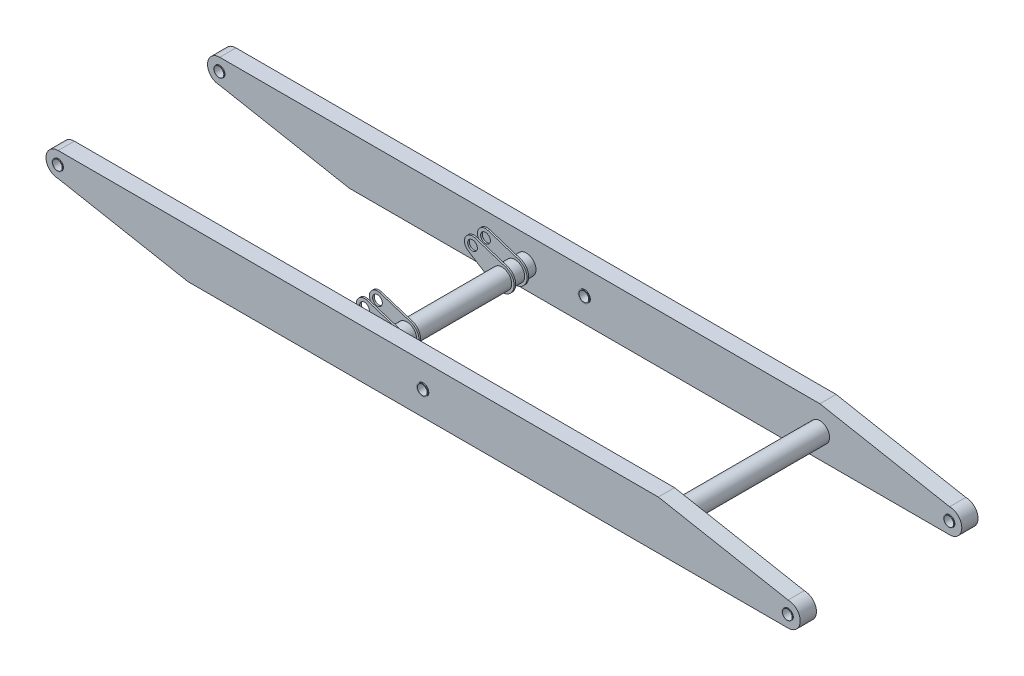
from build123d import *

# Parameters (mm, degrees)
EXTRUDE_1_DEPTH        = 100
SKETCH_2_R             = 30
CUT_EXTRUDE_1_DEPTH    = 100
SKETCH_3_R             = 32.5
SKETCH_3_R_2           = 30
EXTRUDE_2_DEPTH        = 5
EXTRUDE_START          = 5
SKETCH_4_R             = 32.5
SKETCH_4_R_2           = 30
EXTRUDE_3_DEPTH        = 5
SKETCH_5_R             = 30
CUT_EXTRUDE_3_DEPTH    = 552
SKETCH_6_R             = 35
SKETCH_6_R_2           = 30
EXTRUDE_4_DEPTH        = 5
SKETCH_7_R             = 35
SKETCH_7_R_2           = 30
EXTRUDE_5_DEPTH        = 5
SKETCH_8_R             = 60
EXTRUDE_6_DEPTH        = 448
SKETCH_9_R             = 60
EXTRUDE_7_DEPTH        = 896
EXTRUDE_8_DEPTH        = 10
EXTRUDE_10_DEPTH       = 10
CUT_EXTRUDE_START      = -10
CUT_EXTRUDE_6_DEPTH    = 10
PATTERN_LINEAR_2_COUNT = 2
PATTERN_LINEAR_2_PITCH = 80
SKETCH_16_R            = 30
CUT_EXTRUDE_7_DEPTH    = 95
MIRROR_START           = -160
MIRROR_3_OUTLINE_R     = 30
MIRROR_3_DEPTH         = 10
MIRROR_START_2         = -80
MIRROR_3_2_OUTLINE_R   = 30
MIRROR_3_2_DEPTH       = 10
SCALE1_SCALE           = 0.345


# Read off the part's stored shape, not the designer's step: 镜向3
with BuildPart() as part:
    # 草图1 → 凸台-拉伸1 (new body)
    with BuildSketch(Plane.XY):
        with BuildLine():
            Line((-60.1323511, -127.533248731), (739.8676489, -277.533248731))
            Line((739.8676489, -277.533248731), (4439.8676489, -277.533248731))
            ThreePointArc((4439.8676489, -277.533248731), (4514.8676489, -202.533248731), (4439.8676489, -127.533248731))
            Line((4439.8676489, -127.533248731), (3639.8676489, 22.466751269))
            Line((3639.8676489, 22.466751269), (-60.1323511, 22.466751269))
            ThreePointArc((-60.1323511, 22.466751269), (-135.1323511, -52.533248731), (-60.1323511, -127.533248731))
        make_face()
    extrude(amount=EXTRUDE_1_DEPTH)

    # 草图2 → 切除-拉伸1 (cut)
    with BuildSketch(Plane.XY.offset(100)):
        with Locations((-60.1323511, -52.533248731)):
            Circle(SKETCH_2_R)
        with Locations((4439.8676489, -202.533248731)):
            Circle(SKETCH_2_R)
    extrude(amount=-CUT_EXTRUDE_1_DEPTH, mode=Mode.SUBTRACT)

    # 草图3 → 凸台-拉伸2 (add)
    # profile 1 of 2: a face of its own
    with BuildSketch(Plane(origin=(0, 0, 0), x_dir=(-1, 0, 0), z_dir=(0, 0, -1))):
        with Locations(Location((-4439.8676489, -202.533248731, 0), (0, 0, 180))):
            Circle(SKETCH_3_R)
        with Locations(Location((-4439.8676489, -202.533248731, 0), (0, 0, 180))):
            Circle(SKETCH_3_R_2, mode=Mode.SUBTRACT)
    # profile 2 of 2: a face of its own
    with BuildSketch(Plane(origin=(0, 0, 0), x_dir=(-1, 0, 0), z_dir=(0, 0, -1))):
        with Locations(Location((60.1323511, -52.533248731, 0), (0, 0, 180))):
            Circle(SKETCH_3_R)
        with Locations(Location((60.1323511, -52.533248731, 0), (0, 0, 180))):
            Circle(SKETCH_3_R_2, mode=Mode.SUBTRACT)
    extrude(amount=EXTRUDE_2_DEPTH)

    # 草图4 → 凸台-拉伸3 (add)
    # profile 1 of 2: a face of its own
    with BuildSketch(Plane.XY.offset(100).offset(EXTRUDE_START)):
        with Locations((-60.1323511, -52.533248731)):
            Circle(SKETCH_4_R)
        with Locations((-60.1323511, -52.533248731)):
            Circle(SKETCH_4_R_2, mode=Mode.SUBTRACT)
    # profile 2 of 2: a face of its own
    with BuildSketch(Plane.XY.offset(100).offset(EXTRUDE_START)):
        with Locations((4439.8676489, -202.533248731)):
            Circle(SKETCH_4_R)
        with Locations((4439.8676489, -202.533248731)):
            Circle(SKETCH_4_R_2, mode=Mode.SUBTRACT)
    extrude(amount=-EXTRUDE_3_DEPTH)

    # 草图5 → 切除-拉伸3 (cut)
    with BuildSketch(Plane(origin=(0, 0, 0), x_dir=(-1, 0, 0), z_dir=(0, 0, -1))):
        with Locations((-2189.8676489, -127.533248731)):
            Circle(SKETCH_5_R)
    extrude(amount=-CUT_EXTRUDE_3_DEPTH, mode=Mode.SUBTRACT)

    # 草图6 → 凸台-拉伸4 (add)
    with BuildSketch(Plane.XY.offset(100)):
        with Locations((2189.8676489, -127.533248731)):
            Circle(SKETCH_6_R)
        with Locations(Location((2189.8676489, -127.533248731, 0), (0, 0, 180))):
            Circle(SKETCH_6_R_2, mode=Mode.SUBTRACT)
    extrude(amount=EXTRUDE_4_DEPTH)

    # 草图7 → 凸台-拉伸5 (add)
    with BuildSketch(Plane(origin=(0, 0, 0), x_dir=(-1, 0, 0), z_dir=(0, 0, -1)).offset(EXTRUDE_START)):
        with Locations(Location((-2189.8676489, -127.533248731, 0), (0, 0, 180))):
            Circle(SKETCH_7_R)
        with Locations((-2189.8676489, -127.533248731)):
            Circle(SKETCH_7_R_2, mode=Mode.SUBTRACT)
    extrude(amount=-EXTRUDE_5_DEPTH)

    # 草图8 → 凸台-拉伸6 (add)
    with BuildSketch(Plane(origin=(0, 0, 0), x_dir=(-1, 0, 0), z_dir=(0, 0, -1))):
        with Locations(Location((-3639.8676489, -127.533248731, 0), (0, 0, 180))):
            Circle(SKETCH_8_R)
    extrude(amount=EXTRUDE_6_DEPTH)

    # 镜向1: part across plane


with BuildPart() as part_1:
    add(part.part)
    add(part.part.mirror(Plane(origin=(3639.8676489, -127.533248731, -448), x_dir=(1, 0, 0), z_dir=(0, 0, -1))))

    # 草图9 → 凸台-拉伸7 (add)
    with BuildSketch(Plane.XY.offset(-896)):
        with Locations(Location((1839.8676489, -127.533248731, 0), (0, 0, 180))):
            Circle(SKETCH_9_R)
    extrude(amount=EXTRUDE_7_DEPTH)

    # 草图10 → 凸台-拉伸8 (add)
    with BuildSketch(Plane.XY.offset(-896)):
        with BuildLine():
            Line((1631.976489947, -85.328201293), (1799.923246582, -191.011156096))
            ThreePointArc((1799.923246582, -191.011156096), (1907.840732928, -159.229618362), (1862.818780211, -56.131248958))
            Line((1862.818780211, -56.131248958), (1673.9068457, 4.591736799))
            ThreePointArc((1673.9068457, 4.591736799), (1613.290702141, -21.878683296), (1631.976489947, -85.328201293))
        make_face()
    extrude(amount=EXTRUDE_8_DEPTH)

    # 草图14 → 凸台-拉伸10 (add)
    with BuildSketch(Plane.XY.offset(-826)):
        with BuildLine():
            Line((1631.976489947, -85.328201293), (1799.923246582, -191.011156096))
            ThreePointArc((1799.923246582, -191.011156096), (1907.840732928, -159.229618362), (1862.818780211, -56.131248958))
            Line((1862.818780211, -56.131248958), (1673.9068457, 4.591736799))
            ThreePointArc((1673.9068457, 4.591736799), (1613.290702141, -21.878683296), (1631.976489947, -85.328201293))
        make_face()
    extrude_10 = extrude(amount=EXTRUDE_10_DEPTH)

    # 草图15 → 切除-拉伸6 (cut)
    with BuildSketch(Plane.XY.offset(-886).offset(CUT_EXTRUDE_START)):
        with BuildLine():
            Line((1631.976489947, -85.328201293), (1799.923246582, -191.011156096))
            ThreePointArc((1799.923246582, -191.011156096), (1907.840732928, -159.229618362), (1862.818780211, -56.131248958))
            Line((1862.818780211, -56.131248958), (1673.9068457, 4.591736799))
            ThreePointArc((1673.9068457, 4.591736799), (1613.290702141, -21.878683296), (1631.976489947, -85.328201293))
        make_face()
    extrude(amount=CUT_EXTRUDE_6_DEPTH, mode=Mode.SUBTRACT)

    # 阵列(线性)2: 凸台-拉伸10 ×2
    with Locations(*[(0, 0, i * PATTERN_LINEAR_2_PITCH) for i in range(1, PATTERN_LINEAR_2_COUNT)]):
        add(extrude_10)

    # 草图16 → 切除-拉伸7 (cut)
    with BuildSketch(Plane.XY.offset(-736)):
        with Locations((1658.606091493, -43.009596383)):
            Circle(SKETCH_16_R)
    extrude(amount=-CUT_EXTRUDE_7_DEPTH, mode=Mode.SUBTRACT)

    # 镜向3 outline → 镜向3 (add)
    with BuildSketch(Plane.XY.offset(MIRROR_START)):
        with BuildLine():
            Line((1862.818780211, -56.131248958), (1673.9068457, 4.591736799))
            ThreePointArc((1673.9068457, 4.591736799), (1613.290702141, -21.878683296), (1631.976489947, -85.328201293))
            Line((1631.976489947, -85.328201293), (1799.923246582, -191.011156096))
            ThreePointArc((1799.923246582, -191.011156096), (1907.840732928, -159.229618361), (1862.818780211, -56.131248958))
        make_face()
        with Locations((1658.606091493, -43.009596383)):
            Circle(MIRROR_3_OUTLINE_R, mode=Mode.SUBTRACT)
    extrude(amount=MIRROR_3_DEPTH)

    # Mirror 3 2 outline → Mirror 3 2 (add)
    with BuildSketch(Plane.XY.offset(MIRROR_START_2)):
        with BuildLine():
            Line((1862.818780211, -56.131248958), (1673.9068457, 4.591736799))
            ThreePointArc((1673.9068457, 4.591736799), (1613.290702141, -21.878683296), (1631.976489947, -85.328201293))
            Line((1631.976489947, -85.328201293), (1799.923246582, -191.011156096))
            ThreePointArc((1799.923246582, -191.011156096), (1907.840732928, -159.229618361), (1862.818780211, -56.131248958))
        make_face()
        with Locations((1658.606091493, -43.009596383)):
            Circle(MIRROR_3_2_OUTLINE_R, mode=Mode.SUBTRACT)
    extrude(amount=MIRROR_3_2_DEPTH)


with BuildPart() as part_2:
    # Scale1: scaled about (2229.895561812, -127.384045127, -447.813736157)
    add(part_1.part.scale(SCALE1_SCALE).moved(Location((1460.581592987, -83.436549558, -293.317997183))))


solid = part_2.part
